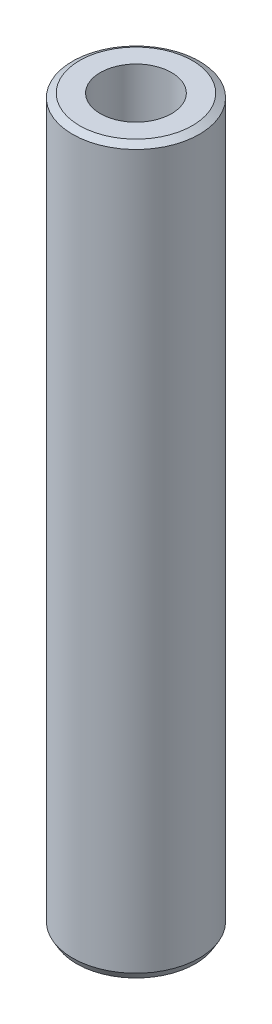
from build123d import *
from OCP.BRepFilletAPI import BRepFilletAPI_MakeChamfer

# Parameters (mm, degrees)
SKETCH1_R           = 32.5
BOSS_EXTRUDE1_DEPTH = 371.418984332
SKETCH2_R           = 18.274156303
CUT_EXTRUDE1_DEPTH  = 375.252003231
CHAMFER1_SIZE       = 2.066574171
CHAMFER1_SIZE2      = 3.579411461


with BuildPart() as part:
    # Sketch1 → Boss-Extrude1 (new body)
    with BuildSketch(Plane(origin=(0, 0, 0), x_dir=(1, 0, 0), z_dir=(0, 1, 0))):
        Circle(SKETCH1_R)
    extrude(amount=BOSS_EXTRUDE1_DEPTH)

    # Sketch2 → Cut-Extrude1 (cut, through all)
    with BuildSketch(Plane(origin=(0, 0, 0), x_dir=(1, 0, 0), z_dir=(0, 1, 0))):
        Circle(SKETCH2_R)
    extrude(amount=CUT_EXTRUDE1_DEPTH, mode=Mode.SUBTRACT)

    # Chamfer1: one chamfer whose edges measure the first distance from different faces: ONE call of the kernel's chamfer builder (chamfer() names one face for all edges)
    chamfer1_edges_1 = [part.edges().sort_by_distance(p)[0] for p in [
        (-32.5, 371.418984332, 0),
    ]]
    chamfer1_side_1 = [part.faces().sort_by_distance(p)[0] for p in [
        (-32.5, 185.709492166, 0),
    ]]
    chamfer1_edges_2 = [part.edges().sort_by_distance(p)[0] for p in [
        (-32.5, 0, 0),
    ]]
    chamfer1_side_2 = [part.faces().sort_by_distance(p)[0] for p in [
        (-31.580761184, 0, 0),
    ]]
    chamfer1 = BRepFilletAPI_MakeChamfer(part.part.solid().wrapped)
    for e in chamfer1_edges_1:
        chamfer1.Add(CHAMFER1_SIZE, CHAMFER1_SIZE2, e.wrapped, chamfer1_side_1[0].wrapped)  # the first distance lies on this face
    for e in chamfer1_edges_2:
        chamfer1.Add(CHAMFER1_SIZE, CHAMFER1_SIZE2, e.wrapped, chamfer1_side_2[0].wrapped)  # the first distance lies on this face
    add(Compound.cast(chamfer1.Shape()), mode=Mode.REPLACE)


solid = part.part
